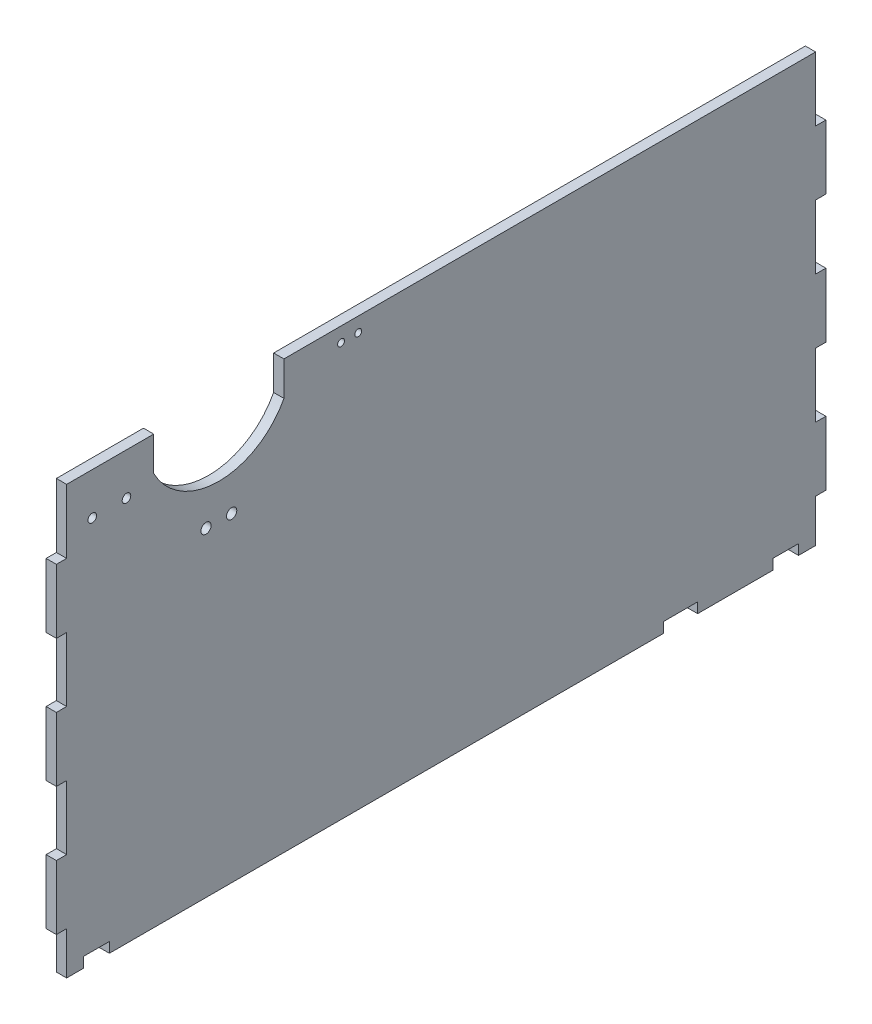
from build123d import *

# Parameters (mm, degrees)
SKETCH1_W            = 450
SKETCH1_H            = 250
BOSS_EXTRUDE1_DEPTH  = 6
SKETCH2_W            = 6
SKETCH2_H            = 37.5
CUT_EXTRUDE1_DEPTH   = 515.816472153
LPATTERN1_COUNT      = 4
LPATTERN1_PITCH      = 75
LPATTERN1_COUNT_DIR2 = 2
LPATTERN1_PITCH_DIR2 = 444
SKETCH3_W            = 15
SKETCH3_H            = 6
CUT_EXTRUDE2_DEPTH   = 515.816472153
LPATTERN2_COUNT      = 2
LPATTERN2_PITCH      = 403
SKETCH4_R            = 3
CUT_EXTRUDE3_DEPTH   = 10
SKETCH5_W            = 20
SKETCH5_H            = 6
CUT_EXTRUDE4_DEPTH   = 515.816472153
SKETCH6_R            = 2.5
SKETCH6_R_2          = 2
CUT_EXTRUDE5_DEPTH   = 515.816472153


with BuildPart() as part:
    # Sketch1 → Boss-Extrude1 (new body)
    with BuildSketch(Plane(origin=(0, 0, 0), x_dir=(0, 0, -1), z_dir=(1, 0, 0))):
        with Locations((-225, 125)):
            Rectangle(SKETCH1_W, SKETCH1_H)
    extrude(amount=BOSS_EXTRUDE1_DEPTH)

    # Sketch2 → Cut-Extrude1 (cut, through all)
    with BuildSketch(Plane(origin=(6, 0, 0), x_dir=(0, 0, -1), z_dir=(1, 0, 0))):
        with Locations((-447, 231.25)):
            Rectangle(SKETCH2_W, SKETCH2_H)
    cut_extrude1 = extrude(amount=-CUT_EXTRUDE1_DEPTH, mode=Mode.SUBTRACT)

    # LPattern1: Cut-Extrude1 4 × 2
    with Locations(*[(0, -i * LPATTERN1_PITCH, -j * LPATTERN1_PITCH_DIR2) for i in range(LPATTERN1_COUNT) for j in range(LPATTERN1_COUNT_DIR2) if (i, j) != (0, 0)]):
        add(cut_extrude1, mode=Mode.SUBTRACT)

    # Sketch3 → Cut-Extrude2 (cut, through all)
    with BuildSketch(Plane(origin=(6, 0, 0), x_dir=(0, 0, -1), z_dir=(1, 0, 0))):
        with Locations((-426.5, 3)):
            Rectangle(SKETCH3_W, SKETCH3_H)
    cut_extrude2 = extrude(amount=-CUT_EXTRUDE2_DEPTH, mode=Mode.SUBTRACT)

    # LPattern2: Cut-Extrude2 ×2
    with Locations(*[(0, 0, -i * LPATTERN2_PITCH) for i in range(1, LPATTERN2_COUNT)]):
        add(cut_extrude2, mode=Mode.SUBTRACT)

    # Sketch4 → Cut-Extrude3 (cut)
    with BuildSketch(Plane(origin=(6, 0, 0), x_dir=(0, 0, -1), z_dir=(1, 0, 0))):
        with Locations((-362.5, 187)):
            Circle(SKETCH4_R)
        with Locations((-347.5, 187)):
            Circle(SKETCH4_R)
        with BuildLine():
            Line((-393.065732621, 230), (-393.065732621, 250))
            Line((-393.065732621, 250), (-316.934267379, 250))
            Line((-316.934267379, 250), (-316.934267379, 230))
            ThreePointArc((-316.934267379, 230), (-355, 207), (-393.065732621, 230))
        make_face()
    extrude(amount=-CUT_EXTRUDE3_DEPTH, mode=Mode.SUBTRACT)

    # Sketch5 → Cut-Extrude4 (cut, through all)
    with BuildSketch(Plane(origin=(6, 0, 0), x_dir=(0, 0, -1), z_dir=(1, 0, 0))):
        with Locations((-85, 3)):
            Rectangle(SKETCH5_W, SKETCH5_H)
    extrude(amount=-CUT_EXTRUDE4_DEPTH, mode=Mode.SUBTRACT)

    # Sketch6 → Cut-Extrude5 (cut, through all)
    with BuildSketch(Plane.ZY):
        with Locations((429, 225.5)):
            Circle(SKETCH6_R)
        with Locations((409, 225.5)):
            Circle(SKETCH6_R)
        with Locations((283.51, 241.5)):
            Circle(SKETCH6_R_2)
        with Locations((273.51, 241.5)):
            Circle(SKETCH6_R_2)
    extrude(amount=-CUT_EXTRUDE5_DEPTH, mode=Mode.SUBTRACT)


solid = part.part
